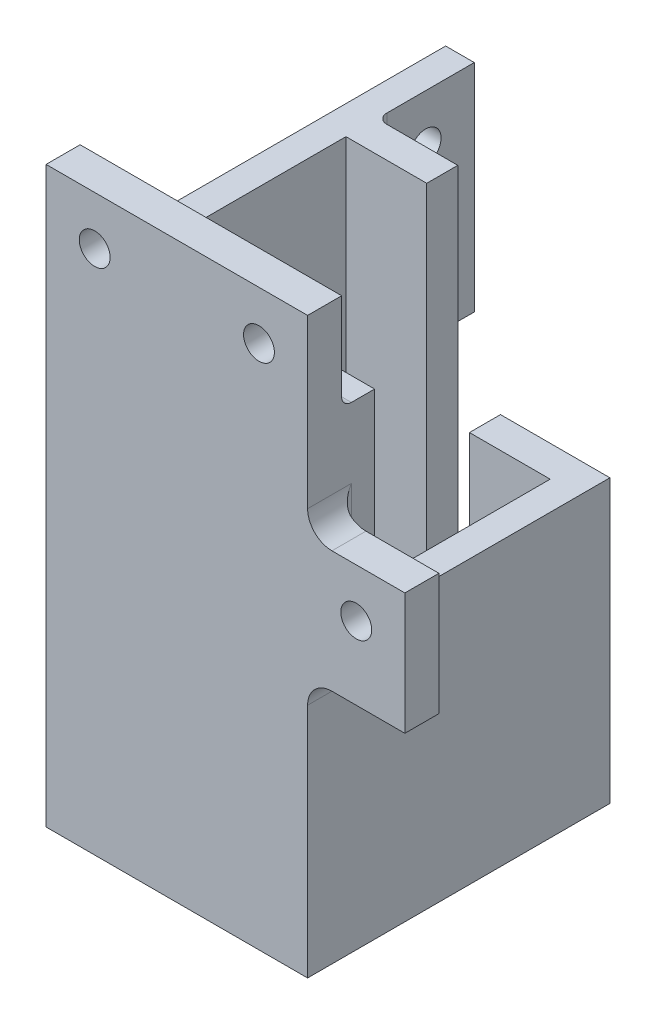
from build123d import *

# Parameters (mm, degrees)
BOSS_EXTRUDE1_DEPTH      = 48
SKETCH2_W                = 53.78
SKETCH2_H                = 62.166
BOSS_EXTRUDE2_DEPTH      = 10
BOSS_EXTRUDE3_DEPTH      = 40
BOSS_EXTRUDE3_DEPTH_BACK = 4.425
SKETCH6_W                = 20
SKETCH6_H                = 19.425
CUT_EXTRUDE3_DEPTH       = 125.870331368
SKETCH7_W                = 53.78
SKETCH7_H                = 7
BOSS_EXTRUDE4_DEPTH      = 20
SKETCH9_W                = 16.61
SKETCH9_H                = 6.39
BOSS_EXTRUDE5_DEPTH      = 40
SKETCH4_R                = 3.175
CUT_EXTRUDE1_DEPTH       = 137.084033597
SKETCH5_R                = 3.175
CUT_EXTRUDE2_DEPTH       = 140.687507158
SKETCH8_R                = 3.175
CUT_EXTRUDE4_DEPTH       = 140.687507158
FILLET1_R                = 2
FILLET2_R                = 5


with BuildPart() as part:
    # Sketch1 → Boss-Extrude1 (new body)
    with BuildSketch(Plane(origin=(0, 0, 0), x_dir=(1, 0, 0), z_dir=(0, 1, 0))):
        Polygon((4.39, 21), (4.39, 27.39), (26.89, 27.39), (26.89, -34.776), (-26.89, -34.776), (-26.89, 27.39), (-4.39, 27.39), (-4.39, 21), (-21, 21), (-21, -21), (21, -21), (21, 21), align=None)
    extrude(amount=BOSS_EXTRUDE1_DEPTH)

    # Sketch2 → Boss-Extrude2 (add)
    with BuildSketch(Plane(origin=(0, 0, 0), x_dir=(1, 0, 0), z_dir=(0, 1, 0))):
        with Locations((0, -3.693)):
            Rectangle(SKETCH2_W, SKETCH2_H)
    extrude(amount=-BOSS_EXTRUDE2_DEPTH)

    # Sketch3 → Boss-Extrude3 (add, two sides: drawn at the far end of the back side and taken through both)
    with BuildSketch(Plane(origin=(0, 48, 0), x_dir=(1, 0, 0), z_dir=(0, 1, 0)).offset(-BOSS_EXTRUDE3_DEPTH_BACK)):
        Polygon((26.89, -21), (26.89, -27.776), (46.89, -27.776), (46.89, -34.776), (-26.89, -34.776), (-26.89, 47.39), (-21, 47.39), (-21, -21), align=None)
    extrude(amount=BOSS_EXTRUDE3_DEPTH + BOSS_EXTRUDE3_DEPTH_BACK)

    # Sketch6 → Cut-Extrude3 (cut, through all)
    with BuildSketch(Plane(origin=(0, 0, 27.776), x_dir=(-1, 0, 0), z_dir=(0, 0, -1))):
        with Locations((-36.89, 78.2875)):
            Rectangle(SKETCH6_W, SKETCH6_H)
    extrude(amount=-CUT_EXTRUDE3_DEPTH, mode=Mode.SUBTRACT)

    # Sketch7 → Boss-Extrude4 (add)
    with BuildSketch(Plane(origin=(0, 88, 0), x_dir=(1, 0, 0), z_dir=(0, 1, 0))):
        with Locations((0, -31.276)):
            Rectangle(SKETCH7_W, SKETCH7_H)
    extrude(amount=BOSS_EXTRUDE4_DEPTH)

    # Sketch9 → Boss-Extrude5 (add)
    with BuildSketch(Plane(origin=(0, 48, 0), x_dir=(1, 0, 0), z_dir=(0, 1, 0))):
        with Locations((-12.695, 24.195)):
            Rectangle(SKETCH9_W, SKETCH9_H)
    extrude(amount=BOSS_EXTRUDE5_DEPTH)

    # Sketch4 → Cut-Extrude1 (cut, through all)
    with BuildSketch(Plane(origin=(-21, 0, 0), x_dir=(0, 0, -1), z_dir=(1, 0, 0))):
        with Locations((37.39, 78)):
            Circle(SKETCH4_R)
        with Locations((37.39, 58.575)):
            Circle(SKETCH4_R)
    extrude(amount=-CUT_EXTRUDE1_DEPTH, mode=Mode.SUBTRACT)

    # Sketch5 → Cut-Extrude2 (cut, through all)
    with BuildSketch(Plane.XY.offset(27.776)):
        with Locations((36.89, 58.575)):
            Circle(SKETCH5_R)
    extrude(amount=CUT_EXTRUDE2_DEPTH, mode=Mode.SUBTRACT)

    # Sketch8 → Cut-Extrude4 (cut, through all)
    with BuildSketch(Plane(origin=(0, 0, 27.776), x_dir=(-1, 0, 0), z_dir=(0, 0, -1))):
        with Locations((-16.89, 98)):
            Circle(SKETCH8_R)
        with Locations((16.89, 98)):
            Circle(SKETCH8_R)
    extrude(amount=-CUT_EXTRUDE4_DEPTH, mode=Mode.SUBTRACT)

    # Fillet1
    fillet1_edges = [part.edges().sort_by_distance(p)[0] for p in [
        (26.89, 56.075, 27.776),
        (0, 88, 27.776),
        (-21, 65.7875, -27.39),
    ]]
    fillet(fillet1_edges, radius=FILLET1_R)

    # Fillet2
    fillet2_edges = [part.edges().sort_by_distance(p)[0] for p in [
        (-22.945, 43.575, -27.39),
    ]]
    fillet(fillet2_edges, radius=FILLET2_R)
    fillet2_2_edges = [part.edges().sort_by_distance(p)[0] for p in [
        (26.89, 68.575, 30.276),
    ]]
    fillet(fillet2_2_edges, radius=FILLET2_R)
    fillet2_3_edges = [part.edges().sort_by_distance(p)[0] for p in [
        (26.89, 43.575, 30.276),
    ]]
    fillet(fillet2_3_edges, radius=FILLET2_R)


solid = part.part
